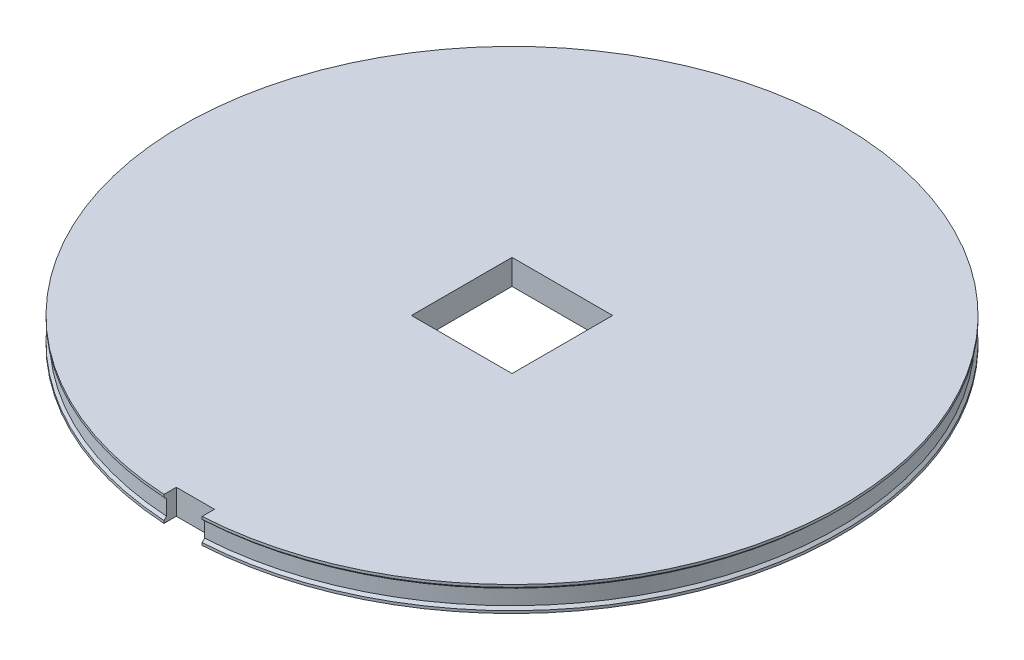
from build123d import *

# Parameters (mm, degrees)
SKIZZE1_R                       = 131
SKIZZE1_W                       = 40
SKIZZE1_H                       = 40
AUFSATZ_LINEAR_AUSTRAGEN1_DEPTH = 10
SKIZZE2_W                       = 15.161428906
SKIZZE2_H                       = 7.514920765
SCHNITT_LINEAR_AUSTRAGEN1_DEPTH = 186.531668456
FASE1_SIZE                      = 1


with BuildPart() as part:
    # Skizze1 → Aufsatz-Linear austragen1 (new body)
    with BuildSketch(Plane(origin=(0, 0, 0), x_dir=(1, 0, 0), z_dir=(0, 1, 0))):
        with Locations(Location((0, 0, 0), (0, 0, 270))):
            Circle(SKIZZE1_R)
        Rectangle(SKIZZE1_W, SKIZZE1_H, mode=Mode.SUBTRACT)
    extrude(amount=AUFSATZ_LINEAR_AUSTRAGEN1_DEPTH)

    # Skizze2 → Schnitt-Linear austragen1 (cut, through all)
    with BuildSketch(Plane(origin=(0, 0, 0), x_dir=(1, 0, 0), z_dir=(0, 1, 0))):
        with Locations((0, -129.62528039)):
            Rectangle(SKIZZE2_W, SKIZZE2_H)
    extrude(amount=SCHNITT_LINEAR_AUSTRAGEN1_DEPTH, mode=Mode.SUBTRACT)

    # Skizze4 → Schnitt-Rotation2 (revolve, cut)
    with BuildSketch(Plane(origin=(0, 0, 0), x_dir=(0, 0, -1), z_dir=(1, 0, 0))):
        Polygon((131, 8), (130, 8), (130, 2), (131, 2), (133.611882568, 2), (133.611882568, 8), align=None)
    revolve(axis=Axis((0, 0, 0), (0, 1, 0)), mode=Mode.SUBTRACT)

    # Fase1
    fase1_edges = [part.edges().sort_by_distance(p)[0] for p in [
        (0, 8, -131),
        (0, 2, -131),
    ]]
    chamfer(fase1_edges, length=FASE1_SIZE - 0.0001)  # a hair under: the kernel refuses the full size


solid = part.part
